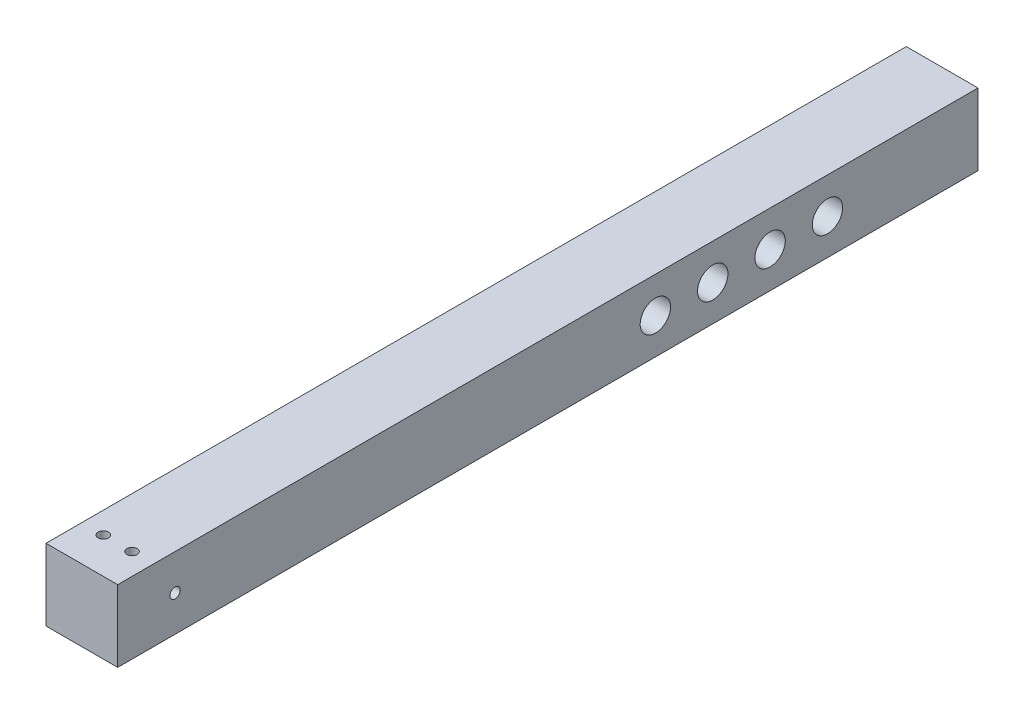
from build123d import *

# Parameters (mm, degrees)
SKETCH1_W               = 25
SKETCH1_H               = 25
BOSS_EXTRUDE1_DEPTH     = 200
SKETCH2_R               = 2.5
CUT_EXTRUDE1_DEPTH      = 202.943680268
SKETCH3_R               = 1.8
CUT_EXTRUDE2_DEPTH      = 202.943680268
SKETCH4_R               = 1.8
CUT_EXTRUDE3_DEPTH      = 202.943680268
CUT_EXTRUDE5_DEPTH      = 202.943680268
CUT_EXTRUDE5_DEPTH_BACK = 202.943680268
SKETCH6_R               = 2.5
CUT_EXTRUDE6_DEPTH      = 202.943680268
CUT_EXTRUDE6_DEPTH_BACK = 202.943680268
SKETCH7_R               = 5.3
CUT_EXTRUDE7_DEPTH      = 202.943680268
CUT_EXTRUDE7_DEPTH_BACK = 202.943680268
SKETCH8_W               = 75
SKETCH8_H               = 25


with BuildPart() as part:
    # Sketch1 → Boss-Extrude1 (new body)
    with BuildSketch(Plane.XY):
        Rectangle(SKETCH1_W, SKETCH1_H)
    boss_extrude1 = extrude(amount=BOSS_EXTRUDE1_DEPTH)

    # Sketch2 → Cut-Extrude1 (cut, through all)
    with BuildSketch(Plane(origin=(12.5, 0, 0), x_dir=(0, 0, -1), z_dir=(1, 0, 0))):
        with Locations((-12.5, 0)):
            Circle(SKETCH2_R)
    cut_extrude1 = extrude(amount=-CUT_EXTRUDE1_DEPTH, mode=Mode.SUBTRACT)

    # Sketch3 → Cut-Extrude2 (cut, through all)
    with BuildSketch(Plane(origin=(0, 12.5, 0), x_dir=(1, 0, 0), z_dir=(0, 1, 0))):
        with Locations((-5, -187.5)):
            Circle(SKETCH3_R)
        with Locations((5, -187.5)):
            Circle(SKETCH3_R)
    cut_extrude2 = extrude(amount=-CUT_EXTRUDE2_DEPTH, mode=Mode.SUBTRACT)

    # Sketch4 → Cut-Extrude3 (cut, symmetric)
    with BuildSketch(Plane.ZY.offset(12.5)):
        with Locations((180, 0)):
            Circle(SKETCH4_R)
    cut_extrude3 = extrude(amount=CUT_EXTRUDE3_DEPTH, both=True, mode=Mode.SUBTRACT)

    # Mirror2: Boss-Extrude1, Cut-Extrude1, Cut-Extrude2, Cut-Extrude3 across plane
    add(boss_extrude1.mirror(Plane(origin=(0, 0, 12.5), x_dir=(1, 0, 0), z_dir=(0, 0, -1))))
    add(cut_extrude1.mirror(Plane(origin=(0, 0, 12.5), x_dir=(1, 0, 0), z_dir=(0, 0, -1))), mode=Mode.SUBTRACT)
    add(cut_extrude2.mirror(Plane(origin=(0, 0, 12.5), x_dir=(1, 0, 0), z_dir=(0, 0, -1))), mode=Mode.SUBTRACT)
    add(cut_extrude3.mirror(Plane(origin=(0, 0, 12.5), x_dir=(1, 0, 0), z_dir=(0, 0, -1))), mode=Mode.SUBTRACT)

    # Sketch6 → Cut-Extrude5 (cut, two sides: drawn at the far end of the back side and taken through both)
    with BuildSketch(Plane(origin=(12.5, 0, 0), x_dir=(0, 0, -1), z_dir=(1, 0, 0)).offset(-CUT_EXTRUDE5_DEPTH_BACK)):
        with Locations((7.5, 0)):
            Circle(SKETCH6_R)
        with Locations((-12.5, 0)):
            Circle(SKETCH6_R)
        with Locations((27.5, 0)):
            Circle(SKETCH6_R)
        with Locations((47.5, 0)):
            Circle(SKETCH6_R)
    extrude(amount=CUT_EXTRUDE5_DEPTH + CUT_EXTRUDE5_DEPTH_BACK, mode=Mode.SUBTRACT)

    # Sketch7 → Cut-Extrude6 (cut, two sides: drawn at the far end of the back side and taken through both)
    with BuildSketch(Plane.ZY.offset(12.5).offset(-CUT_EXTRUDE6_DEPTH_BACK)):
        with Locations((-47.5, 0)):
            Circle(SKETCH7_R)
        with Locations((-27.5, 0)):
            Circle(SKETCH7_R)
        with Locations((-7.5, 0)):
            Circle(SKETCH7_R)
        with Locations((12.5, 0)):
            Circle(SKETCH7_R)
    extrude(amount=CUT_EXTRUDE6_DEPTH + CUT_EXTRUDE6_DEPTH_BACK, mode=Mode.SUBTRACT)

    # Sketch8 → Cut-Extrude7 (cut, two sides: drawn at the far end of the back side and taken through both)
    with BuildSketch(Plane.ZY.offset(12.5).offset(-CUT_EXTRUDE7_DEPTH_BACK)):
        with Locations((-137.5, 0)):
            Rectangle(SKETCH8_W, SKETCH8_H)
    extrude(amount=CUT_EXTRUDE7_DEPTH + CUT_EXTRUDE7_DEPTH_BACK, mode=Mode.SUBTRACT)


solid = part.part
